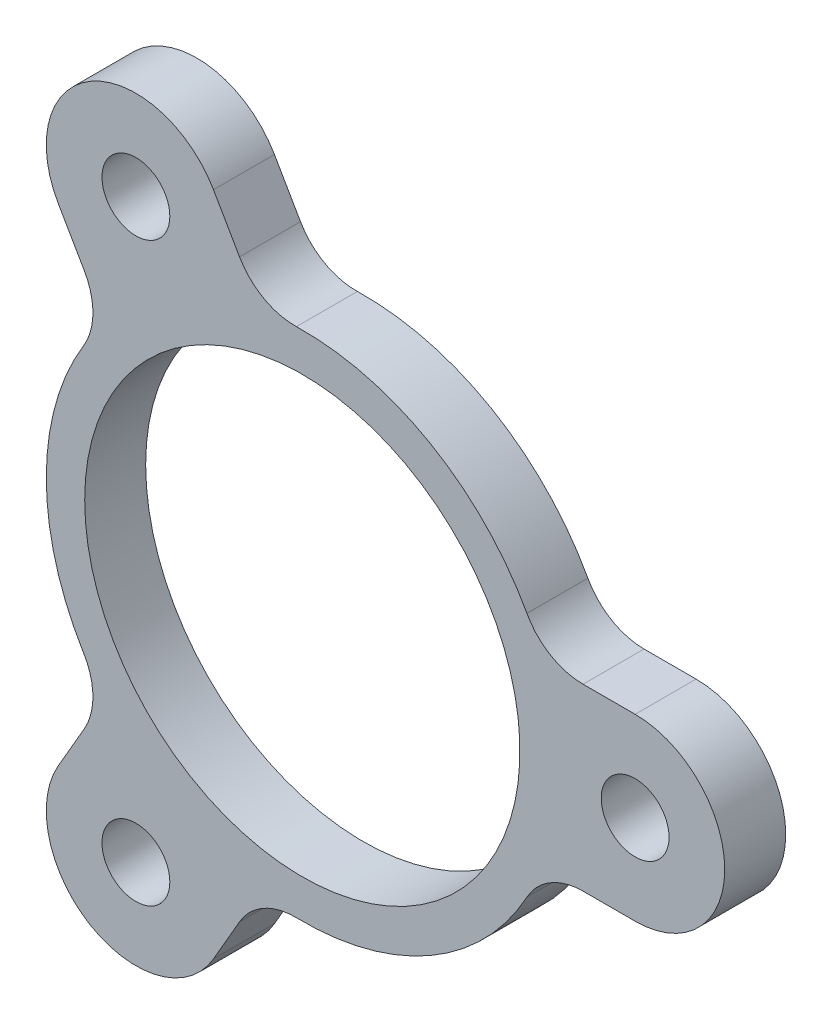
from build123d import *

# Parameters (mm, degrees)
SKETCH1_R            = 17
BOSS_EXTRUDE1_DEPTH  = 4.7625
M5_CLEARANCE_HOLE1_D = 5.3
FILLET1_R            = 5


with BuildPart() as part:
    # Sketch1 → Boss-Extrude1 (new body)
    with BuildSketch(Plane.XY.offset(94.7)):
        with BuildLine():
            ThreePointArc((26, -7), (33, 0), (26, 7))
            Line((26, 7), (18.734993995, 7))
            ThreePointArc((18.734993995, 7), (10, 17.320508076), (-3.305319171, 19.72498074))
            Line((-3.305319171, 19.72498074), (-6.937822174, 26.016660498))
            ThreePointArc((-6.937822174, 26.016660498), (-16.5, 28.578838325), (-19.062177826, 19.016660498))
            Line((-19.062177826, 19.016660498), (-15.429674824, 12.72498074))
            ThreePointArc((-15.429674824, 12.72498074), (-20, 0), (-15.429674824, -12.72498074))
            Line((-15.429674824, -12.72498074), (-19.062177826, -19.016660498))
            ThreePointArc((-19.062177826, -19.016660498), (-16.5, -28.578838325), (-6.937822174, -26.016660498))
            Line((-6.937822174, -26.016660498), (-3.305319171, -19.72498074))
            ThreePointArc((-3.305319171, -19.72498074), (10, -17.320508076), (18.734993995, -7))
            Line((18.734993995, -7), (26, -7))
        make_face()
        Circle(SKETCH1_R, mode=Mode.SUBTRACT)
    extrude(amount=BOSS_EXTRUDE1_DEPTH)

    # M5 Clearance Hole1 (through all)
    with Locations(Plane.XY.offset(99.4625)):
        with Locations((-13, 22.516660498), (26, 0), (-13, -22.516660498)):
            Hole(M5_CLEARANCE_HOLE1_D / 2)

    # Fillet1
    fillet1_edges = [part.edges().sort_by_distance(p)[0] for p in [
        (-3.305319171, -19.72498074, 97.08125),
        (18.734993995, -7, 97.08125),
        (18.734993995, 7, 97.08125),
        (-3.305319171, 19.72498074, 97.08125),
        (-15.429674824, 12.72498074, 97.08125),
        (-15.429674824, -12.72498074, 97.08125),
    ]]
    fillet(fillet1_edges, radius=FILLET1_R)


solid = part.part
